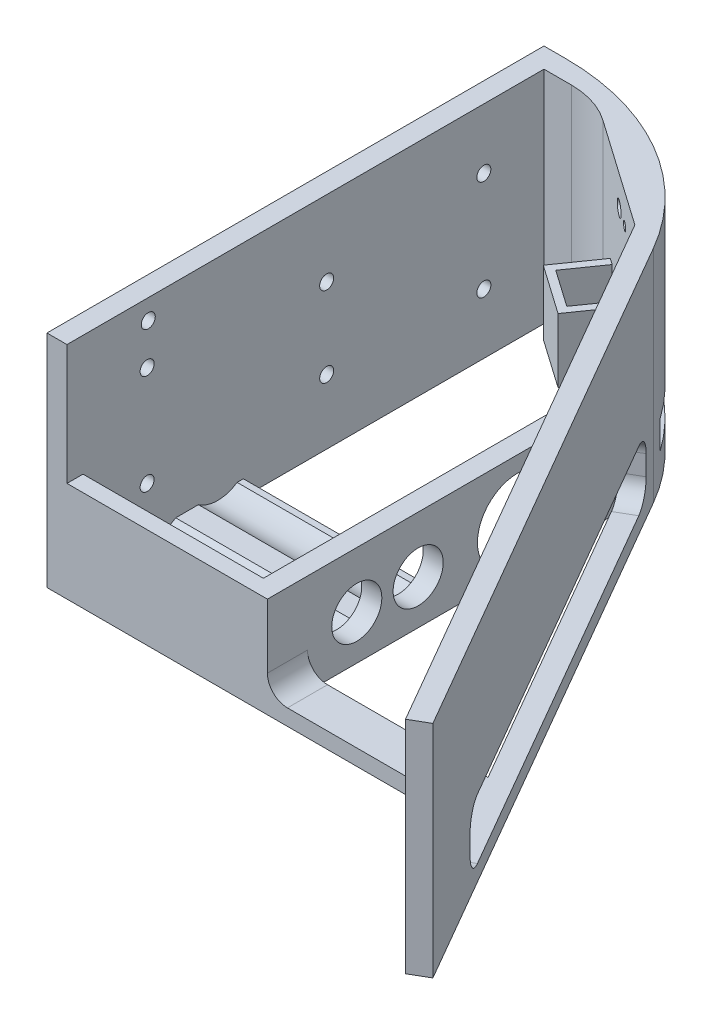
from build123d import *

# Parameters (mm, degrees)
BOSS_EXTRUDE3_DEPTH     = 55
FILLET1_R               = 60
SKETCH4_W               = 15
SKETCH4_H               = 16
BOSS_EXTRUDE4_DEPTH     = 12
CUT_EXTRUDE1_DEPTH      = 20
CUT_EXTRUDE1_DEPTH_BACK = 14
SKETCH5_W               = 40
SKETCH5_H               = 7
CUT_EXTRUDE2_DEPTH      = 14
SKETCH7_R               = 2
CUT_EXTRUDE3_DEPTH      = 2
CUT_EXTRUDE4_DEPTH      = 30
SKETCH9_R               = 10
SKETCH9_R_2             = 6.25
CUT_EXTRUDE5_DEPTH      = 5
SKETCH10_W              = 120
SKETCH10_H              = 15
CUT_EXTRUDE6_DEPTH      = 5
SKETCH11_W              = 4
SKETCH11_H              = 25
BOSS_EXTRUDE5_DEPTH     = 45
FILLET3_R               = 20
BOSS_EXTRUDE6_REACH     = 190.434
SKETCH12_W              = 10
SKETCH12_H              = 4
SKETCH13_W              = 40
SKETCH13_H              = 4
BOSS_EXTRUDE7_DEPTH     = 45
FILLET4_R               = 5
FILLET5_R               = 5
CUT_EXTRUDE7_DEPTH      = 45
SKETCH16_R              = 1.75
CUT_EXTRUDE8_DEPTH      = 5
SKETCH15_R              = 1.75
CUT_EXTRUDE9_DEPTH      = 5
CUT_EXTRUDE10_REACH     = 216.345
SKETCH17_R              = 1.75
SKETCH17_R_2            = 1


with BuildPart() as part:
    # Sketch3 → Boss-Extrude3 (new body)
    with BuildSketch(Plane(origin=(0, 0, 0), x_dir=(1, 0, 0), z_dir=(0, 1, 0))):
        Polygon((128.169872981, -162.7146997), (55, -35.980762114), (55, -124), (50, -124), (50, -27.320508076), (18.123010882, -5), (5, -5), (5, -124), (0, -124), (0, 0), (40, 0), (132.5, -160.2146997), align=None)
    extrude(amount=BOSS_EXTRUDE3_DEPTH)

    # Fillet1
    fillet1_edges = [part.edges().sort_by_distance(p)[0] for p in [
        (40, 27.5, 0),
    ]]
    fillet(fillet1_edges, radius=FILLET1_R)

    # Sketch4 → Boss-Extrude4 (add)
    with BuildSketch(Plane(origin=(3.613056499, 0, -5.159979438), x_dir=(0.8191520442889911, 0, 0.5735764363510469), z_dir=(-0.5735764363510469, 0, 0.8191520442889911))):
        with Locations((39.128001876, 22.366188336)):
            Rectangle(SKETCH4_W, SKETCH4_H)
    extrude(amount=BOSS_EXTRUDE4_DEPTH)

    # Sketch5 → Cut-Extrude1 (cut, two sides: drawn at the far end of the back side and taken through both)
    with BuildSketch(Plane(origin=(3.613056499, 0, -5.159979438), x_dir=(0.8191520442889911, 0, 0.5735764363510469), z_dir=(-0.5735764363510469, 0, 0.8191520442889911)).offset(-CUT_EXTRUDE1_DEPTH_BACK)):
        with Locations((39.128001876, 10.866188336)):
            Rectangle(SKETCH5_W, SKETCH5_H)
    extrude(amount=CUT_EXTRUDE1_DEPTH + CUT_EXTRUDE1_DEPTH_BACK, mode=Mode.SUBTRACT)

    # Sketch6 → Cut-Extrude2 (cut)
    with BuildSketch(Plane(origin=(0, 30.366188336, 0), x_dir=(1, 0, 0), z_dir=(0, 1, 0))):
        Polygon((31.077587777, -14.070892396), (25.28446577, -22.344328043), (34.458968666, -28.76838413), (40.252090673, -20.494948483), align=None)
    extrude(amount=-CUT_EXTRUDE2_DEPTH, mode=Mode.SUBTRACT)

    # Sketch7 → Cut-Extrude3 (cut)
    with BuildSketch(Plane(origin=(0, 16.366188336, 0), x_dir=(1, 0, 0), z_dir=(0, 1, 0))):
        with Locations(Location((32.768278221, -21.419638263, 0), (0, 0, 270))):
            Circle(SKETCH7_R)
    extrude(amount=-CUT_EXTRUDE3_DEPTH, mode=Mode.SUBTRACT)

    # Sketch8 → Cut-Extrude4 (cut)
    with BuildSketch(Plane(origin=(0, 55, 0), x_dir=(1, 0, 0), z_dir=(0, 1, 0))):
        Polygon((55, -35.980762114), (50, -27.320508076), (50, -124), (55, -124), align=None)
    extrude(amount=-CUT_EXTRUDE4_DEPTH, mode=Mode.SUBTRACT)

    # Sketch9 → Cut-Extrude5 (cut)
    with BuildSketch(Plane.ZY.offset(-50)):
        with Locations((61.598678321, 11)):
            Circle(SKETCH9_R)
        with Locations((86.385123427, 11)):
            Circle(SKETCH9_R_2)
        with Locations((101.700022006, 11)):
            Circle(SKETCH9_R_2)
    extrude(amount=-CUT_EXTRUDE5_DEPTH, mode=Mode.SUBTRACT)

    # Sketch10 → Cut-Extrude6 (cut)
    with BuildSketch(Plane(origin=(30, 0, -17.320508076), x_dir=(-0.5000000000000047, 0, -0.866025403784436), z_dir=(0.866025403784436, 0, -0.5000000000000047))):
        with Locations((-119.641016151, 11.5)):
            Rectangle(SKETCH10_W, SKETCH10_H)
    extrude(amount=-CUT_EXTRUDE6_DEPTH, mode=Mode.SUBTRACT)

    # Sketch11 → Boss-Extrude5 (add)
    with BuildSketch(Plane.ZY.offset(-50)):
        with Locations((122, 12.5)):
            Rectangle(SKETCH11_W, SKETCH11_H)
    extrude(amount=BOSS_EXTRUDE5_DEPTH)

    # Fillet3
    # the kernel refuses this fillet: 20 mm, written as the material it adds along each edge
    with BuildSketch(Plane(origin=(18.123010882, 0, 5), x_dir=(-1, 0, 0), z_dir=(0, 1, 0))) as fillet3_piece_1_section:
        with BuildLine():
            CenterArc((FILLET3_R * 0.315298788879, FILLET3_R), FILLET3_R, 235, 35)
            Line((-FILLET3_R * 0.258277647472, FILLET3_R * 0.180847955711), (0, 0))
            Line((0, 0), (FILLET3_R * 0.315298788879, 0))
        make_face()
    fillet3_piece_1 = extrude(amount=55, mode=Mode.PRIVATE)
    fillet3_piece_1 = split(fillet3_piece_1, bisect_by=Plane(origin=(18.647698148, 3.683094168, 6.716980636), z_dir=(-0.8191520442889912, 0, -0.5735764363510469)), keep=Keep.TOP, mode=Mode.PRIVATE)
    fillet3_piece_1 = split(fillet3_piece_1, bisect_by=Plane(origin=(16.403340896, 7.366188336, 5.14546477), z_dir=(0, -1, 0)), keep=Keep.TOP, mode=Mode.PRIVATE)
    add(fillet3_piece_1)
    with BuildSketch(Plane(origin=(18.123010882, 0, 5), x_dir=(-1, 0, 0), z_dir=(0, 1, 0))) as fillet3_piece_2_section:
        with BuildLine():
            CenterArc((FILLET3_R * 0.315298788879, FILLET3_R), FILLET3_R, 235, 35)
            Line((-FILLET3_R * 0.258277647472, FILLET3_R * 0.180847955711), (0, 0))
            Line((0, 0), (FILLET3_R * 0.315298788879, 0))
        make_face()
    fillet3_piece_2 = extrude(amount=55, mode=Mode.PRIVATE)
    fillet3_piece_2 = split(fillet3_piece_2, bisect_by=Plane(origin=(19.32323837, 3.683094168, 5.752209215), z_dir=(0.8191520442889912, 0, 0.5735764363510469)), keep=Keep.TOP, mode=Mode.PRIVATE)
    fillet3_piece_2 = split(fillet3_piece_2, bisect_by=Plane(origin=(20.990357579, 7.366188336, 6.919538653), z_dir=(0, -1, 0)), keep=Keep.TOP, mode=Mode.PRIVATE)
    add(fillet3_piece_2)
    with BuildSketch(Plane(origin=(18.123010882, 0, 5), x_dir=(-1, 0, 0), z_dir=(0, 1, 0))) as fillet3_piece_3_section:
        with BuildLine():
            CenterArc((FILLET3_R * 0.315298788879, FILLET3_R), FILLET3_R, 235, 35)
            Line((-FILLET3_R * 0.258277647472, FILLET3_R * 0.180847955711), (0, 0))
            Line((0, 0), (FILLET3_R * 0.315298788879, 0))
        make_face()
    fillet3_piece_3 = extrude(amount=55, mode=Mode.PRIVATE)
    fillet3_piece_3 = split(fillet3_piece_3, bisect_by=Plane(origin=(16.403340896, 14.366188336, 5.14546477), z_dir=(0, -1, 0)), keep=Keep.TOP, mode=Mode.PRIVATE)
    fillet3_piece_3 = split(fillet3_piece_3, bisect_by=Plane(origin=(18.647698148, 10.866188336, 6.716980636), z_dir=(-0.8191520442889912, 0, -0.5735764363510469)), keep=Keep.TOP, mode=Mode.PRIVATE)
    fillet3_piece_3 = split(fillet3_piece_3, bisect_by=Plane(origin=(16.403340896, 7.366188336, 5.14546477), z_dir=(0, 1, 0)), keep=Keep.TOP, mode=Mode.PRIVATE)
    add(fillet3_piece_3)
    with BuildSketch(Plane(origin=(18.123010882, 0, 5), x_dir=(-1, 0, 0), z_dir=(0, 1, 0))) as fillet3_piece_4_section:
        with BuildLine():
            CenterArc((FILLET3_R * 0.315298788879, FILLET3_R), FILLET3_R, 235, 35)
            Line((-FILLET3_R * 0.258277647472, FILLET3_R * 0.180847955711), (0, 0))
            Line((0, 0), (FILLET3_R * 0.315298788879, 0))
        make_face()
    fillet3_piece_4 = extrude(amount=55, mode=Mode.PRIVATE)
    fillet3_piece_4 = split(fillet3_piece_4, bisect_by=Plane(origin=(16.403340896, 14.366188336, 5.14546477), z_dir=(0, 1, 0)), keep=Keep.TOP, mode=Mode.PRIVATE)
    fillet3_piece_4 = split(fillet3_piece_4, bisect_by=Plane(origin=(18.647698148, 34.683094168, 6.716980636), z_dir=(-0.8191520442889912, 0, -0.5735764363510469)), keep=Keep.TOP, mode=Mode.PRIVATE)
    add(fillet3_piece_4)
    with BuildSketch(Plane(origin=(18.123010882, 0, 5), x_dir=(-1, 0, 0), z_dir=(0, 1, 0))) as fillet3_piece_5_section:
        with BuildLine():
            CenterArc((FILLET3_R * 0.315298788879, FILLET3_R), FILLET3_R, 235, 35)
            Line((-FILLET3_R * 0.258277647472, FILLET3_R * 0.180847955711), (0, 0))
            Line((0, 0), (FILLET3_R * 0.315298788879, 0))
        make_face()
    fillet3_piece_5 = extrude(amount=55, mode=Mode.PRIVATE)
    fillet3_piece_5 = split(fillet3_piece_5, bisect_by=Plane(origin=(20.990357579, 14.366188336, 6.919538653), z_dir=(0, 1, 0)), keep=Keep.TOP, mode=Mode.PRIVATE)
    fillet3_piece_5 = split(fillet3_piece_5, bisect_by=Plane(origin=(19.32323837, 34.683094168, 5.752209215), z_dir=(0.8191520442889912, 0, 0.5735764363510469)), keep=Keep.TOP, mode=Mode.PRIVATE)
    add(fillet3_piece_5)

    # Boss-Extrude6: up to this plane
    boss_extrude6_end = Plane(origin=(128.169872981, 55, 162.7146997), z_dir=(-0.8660254037844362, 0, 0.5000000000000044))
    # Sketch12 → Boss-Extrude6 (add, up to the surface)
    with BuildSketch(Plane(origin=(55, 0, 0), x_dir=(0, 0, -1), z_dir=(1, 0, 0)), mode=Mode.PRIVATE) as boss_extrude6_sk1:
        with Locations((-119, 2)):
            Rectangle(SKETCH12_W, SKETCH12_H)
    boss_extrude6_tool1 = split(extrude(boss_extrude6_sk1.sketch, amount=BOSS_EXTRUDE6_REACH, mode=Mode.PRIVATE), bisect_by=boss_extrude6_end, keep=Keep.BOTH, mode=Mode.PRIVATE)
    add(boss_extrude6_tool1.solids().sort_by_distance((55, 2, 119))[0])

    # Sketch13 → Boss-Extrude7 (add)
    with BuildSketch(Plane.ZY.offset(-50)):
        with Locations((100, 2)):
            Rectangle(SKETCH13_W, SKETCH13_H)
    extrude(amount=BOSS_EXTRUDE7_DEPTH)

    # Fillet4
    fillet4_edges = [part.edges().sort_by_distance(p)[0] for p in [
        (57.655444566, 4, 35.580127019),
        (57.655444566, 19, 35.580127019),
        (117.655444566, 19, 139.503175473),
        (117.655444566, 4, 139.503175473),
    ]]
    fillet(fillet4_edges, radius=FILLET4_R)

    # Fillet5
    fillet5_edges = [part.edges().sort_by_distance(p)[0] for p in [
        (55, 4, 119),
    ]]
    fillet(fillet5_edges, radius=FILLET5_R)

    # Sketch14 → Cut-Extrude7 (cut)
    with BuildSketch(Plane.ZY.offset(-50)):
        with BuildLine():
            ThreePointArc((94.042572717, 14.689643665), (77.885123427, 11), (94.042572717, 7.310356335))
            ThreePointArc((94.042572717, 7.310356335), (110.200022006, 11), (94.042572717, 14.689643665))
        make_face()
    extrude(amount=CUT_EXTRUDE7_DEPTH, mode=Mode.SUBTRACT)

    # Sketch16 → Cut-Extrude8 (cut)
    with BuildSketch(Plane.ZY):
        with Locations((59.208509529, 36.135781847)):
            Circle(SKETCH16_R)
        with Locations((59.208509529, 16.135781847)):
            Circle(SKETCH16_R)
        with Locations((103.718271361, 50.013687011)):
            Circle(SKETCH16_R)
    extrude(amount=-CUT_EXTRUDE8_DEPTH, mode=Mode.SUBTRACT)

    # Sketch15 → Cut-Extrude9 (cut)
    with BuildSketch(Plane.ZY):
        with Locations((104, 40)):
            Circle(SKETCH15_R)
        with Locations((104, 15)):
            Circle(SKETCH15_R)
        with Locations((20, 15)):
            Circle(SKETCH15_R)
        with Locations((20, 40)):
            Circle(SKETCH15_R)
    extrude(amount=-CUT_EXTRUDE9_DEPTH, mode=Mode.SUBTRACT)

    # Cut-Extrude10: up to this plane
    cut_extrude10_end = Plane(origin=(18.123010882, 55, 5), z_dir=(0.5735764363510469, 0, -0.8191520442889914))
    # Sketch17 → Cut-Extrude10 (cut, up to the surface)
    with BuildSketch(Plane(origin=(30, 0, -17.320508076), x_dir=(-0.5000000000000047, 0, -0.866025403784436), z_dir=(0.866025403784436, 0, -0.5000000000000047)), mode=Mode.PRIVATE) as cut_extrude10_sk1:
        with Locations((-34.202339372, 47.5)):
            Circle(SKETCH17_R)
    cut_extrude10_tool1 = split(extrude(cut_extrude10_sk1.sketch, amount=-CUT_EXTRUDE10_REACH, mode=Mode.PRIVATE), bisect_by=cut_extrude10_end, keep=Keep.BOTH, mode=Mode.PRIVATE)
    add(cut_extrude10_tool1.solids().sort_by_distance((47.10117, 47.5, 12.299587))[0], mode=Mode.SUBTRACT)
    # Sketch17 → Cut-Extrude10 (cut, up to the surface)
    with BuildSketch(Plane(origin=(30, 0, -17.320508076), x_dir=(-0.5000000000000047, 0, -0.866025403784436), z_dir=(0.866025403784436, 0, -0.5000000000000047)), mode=Mode.PRIVATE) as cut_extrude10_sk2:
        with Locations((-39.202339372, 47.5)):
            Circle(SKETCH17_R_2)
    cut_extrude10_tool2 = split(extrude(cut_extrude10_sk2.sketch, amount=-CUT_EXTRUDE10_REACH, mode=Mode.PRIVATE), bisect_by=cut_extrude10_end, keep=Keep.BOTH, mode=Mode.PRIVATE)
    add(cut_extrude10_tool2.solids().sort_by_distance((49.60117, 47.5, 16.629714))[0], mode=Mode.SUBTRACT)


solid = part.part
